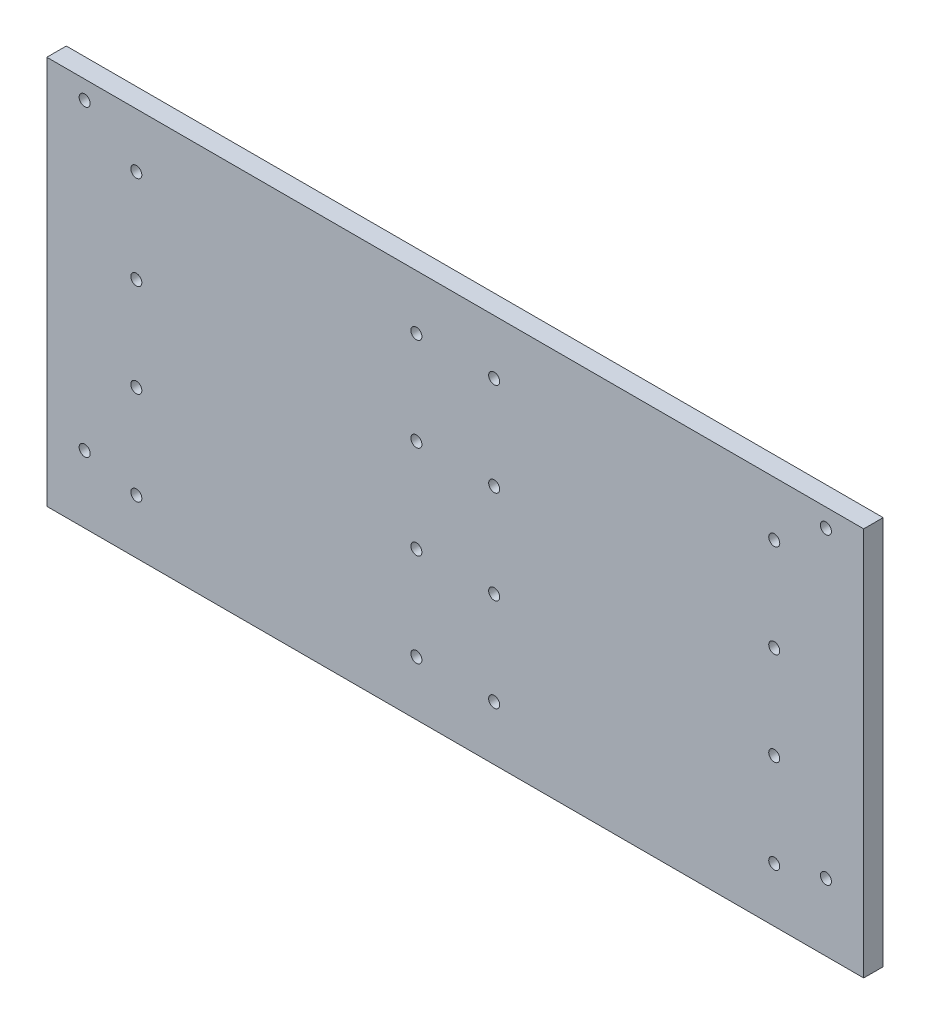
from build123d import *

# Parameters (mm, degrees)
SKETCH1_W            = 266.7
SKETCH1_H            = 127
BOSS_EXTRUDE1_DEPTH  = 6.35
M3_CLEARANCE_HOLE1_D = 3.6
M3_CLEARANCE_HOLE2_D = 3.6
LPATTERN2_COUNT      = 4
LPATTERN2_PITCH      = 30.48


with BuildPart() as part:
    # Sketch1 → Boss-Extrude1 (new body)
    with BuildSketch(Plane.XY):
        with Locations((133.35, 63.5)):
            Rectangle(SKETCH1_W, SKETCH1_H)
    extrude(amount=BOSS_EXTRUDE1_DEPTH)

    # M3 Clearance Hole1 (through all)
    with Locations(Plane.XY.offset(6.35)):
        with Locations((12.3444, 121.0056), (12.3444, 21.9964), (254.3556, 21.9964), (254.3556, 121.0056)):
            Hole(M3_CLEARANCE_HOLE1_D / 2)

    # M3 Clearance Hole2 (through all)
    with Locations(Plane.XY.offset(6.35)):
        with Locations((29.21, 109.22), (120.65, 109.22), (146.05, 109.22), (237.49, 109.22)):
            m3_clearance_hole2 = Hole(M3_CLEARANCE_HOLE2_D / 2)

    # LPattern2: M3 Clearance Hole2 ×4
    with Locations(*[(0, -i * LPATTERN2_PITCH, 0) for i in range(1, LPATTERN2_COUNT)]):
        add(m3_clearance_hole2, mode=Mode.SUBTRACT)


solid = part.part
